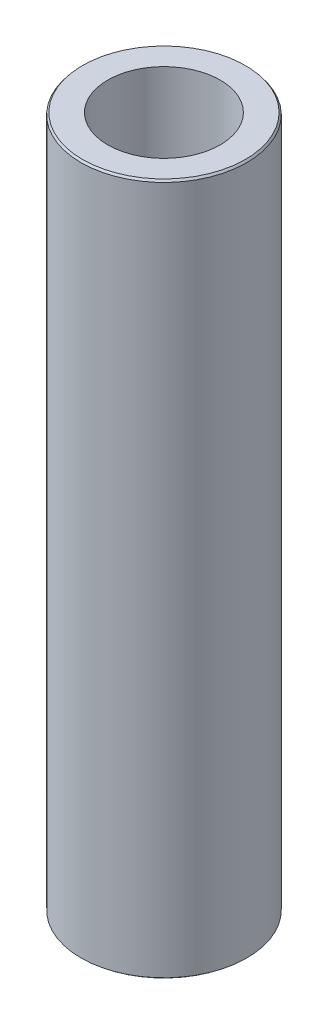
from build123d import *
from OCP.BRepFilletAPI import BRepFilletAPI_MakeChamfer

# Parameters (mm, degrees)
SKETCH1_R           = 30
BOSS_EXTRUDE1_DEPTH = 250.318759968
SKETCH2_R           = 20.325312249
CUT_EXTRUDE1_DEPTH  = 254.888718914
CHAMFER1_SIZE       = 0.703427153
CHAMFER1_SIZE2      = 0.561120116


with BuildPart() as part:
    # Sketch1 → Boss-Extrude1 (new body)
    with BuildSketch(Plane(origin=(0, 0, 0), x_dir=(1, 0, 0), z_dir=(0, 1, 0))):
        Circle(SKETCH1_R)
    extrude(amount=BOSS_EXTRUDE1_DEPTH)

    # Sketch2 → Cut-Extrude1 (cut, through all)
    with BuildSketch(Plane(origin=(0, 0, 0), x_dir=(1, 0, 0), z_dir=(0, 1, 0))):
        Circle(SKETCH2_R)
    extrude(amount=CUT_EXTRUDE1_DEPTH, mode=Mode.SUBTRACT)

    # Chamfer1: one chamfer whose edges measure the first distance from different faces: ONE call of the kernel's chamfer builder (chamfer() names one face for all edges)
    chamfer1_edges_1 = [part.edges().sort_by_distance(p)[0] for p in [
        (-30, 250.318759968, 0),
    ]]
    chamfer1_side_1 = [part.faces().sort_by_distance(p)[0] for p in [
        (-30, 125.159379984, 0),
    ]]
    chamfer1_edges_2 = [part.edges().sort_by_distance(p)[0] for p in [
        (-30, 0, 0),
    ]]
    chamfer1_side_2 = [part.faces().sort_by_distance(p)[0] for p in [
        (-29.151471863, 0, 0),
    ]]
    chamfer1 = BRepFilletAPI_MakeChamfer(part.part.solid().wrapped)
    for e in chamfer1_edges_1:
        chamfer1.Add(CHAMFER1_SIZE, CHAMFER1_SIZE2, e.wrapped, chamfer1_side_1[0].wrapped)  # the first distance lies on this face
    for e in chamfer1_edges_2:
        chamfer1.Add(CHAMFER1_SIZE, CHAMFER1_SIZE2, e.wrapped, chamfer1_side_2[0].wrapped)  # the first distance lies on this face
    add(Compound.cast(chamfer1.Shape()), mode=Mode.REPLACE)


solid = part.part
